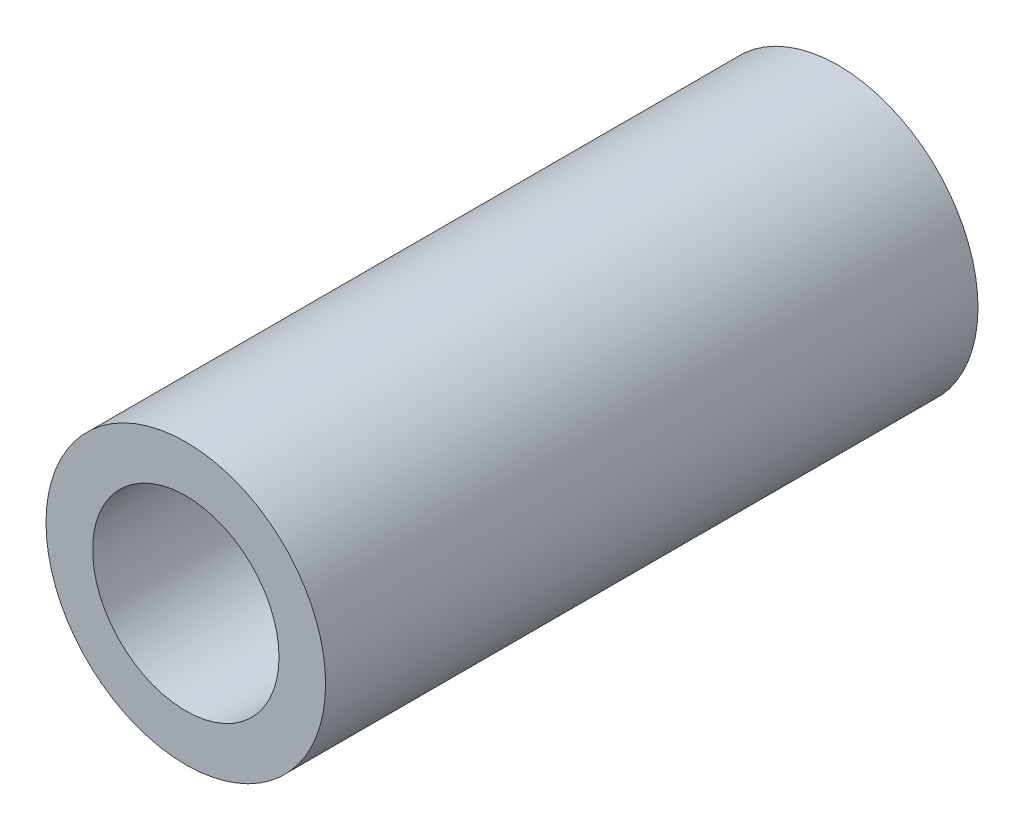
from build123d import *

# Parameters (mm, degrees)
SKETCH1_R           = 3
SKETCH1_R_2         = 2
BOSS_EXTRUDE1_DEPTH = 14


with BuildPart() as part:
    # Sketch1 → Boss-Extrude1 (new body)
    with BuildSketch(Plane.XY):
        Circle(SKETCH1_R)
        Circle(SKETCH1_R_2, mode=Mode.SUBTRACT)
    extrude(amount=BOSS_EXTRUDE1_DEPTH)


solid = part.part
